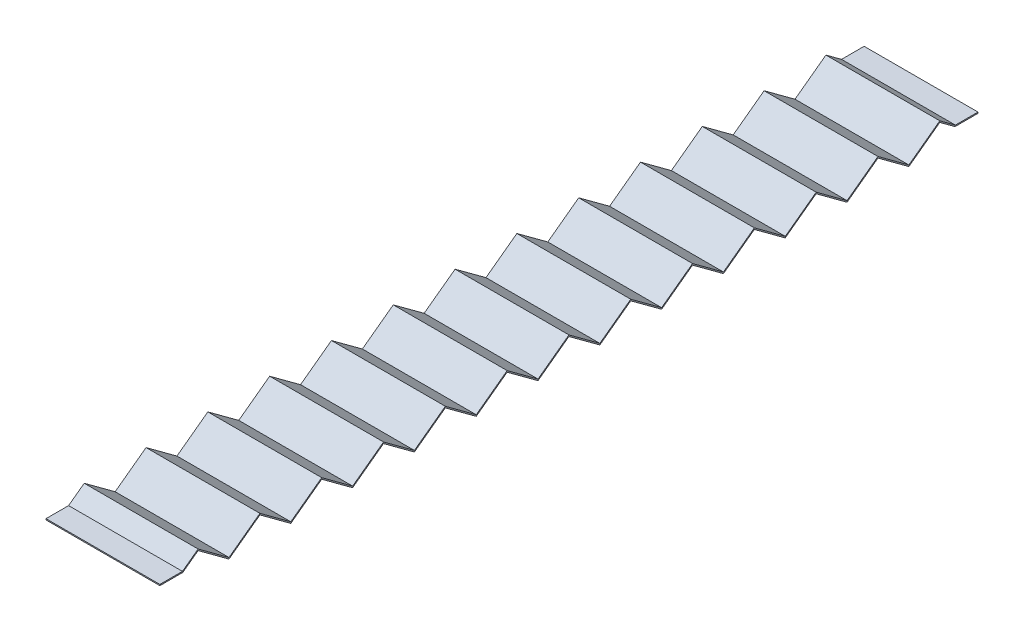
from build123d import *

# Parameters (mm, degrees)
EXTRUDE_THIN1_DEPTH = 25


with BuildPart() as part:
    # Sketch3 → Extrude-Thin1 (new, symmetric)
    with BuildSketch(Plane(origin=(0, 0, 0), x_dir=(0, 0, -1), z_dir=(1, 0, 0))):
        Polygon((0, 4.75), (10.082168565, 4.75), (16.784629538, 9.689445062), (30.353888615, -0.310554938), (43.923147692, 9.689445062), (57.492406769, -0.310554938), (71.061665846, 9.689445062), (84.630924923, -0.310554938), (98.200184, 9.689445062), (111.769443077, -0.310554938), (125.338702154, 9.689445062), (138.907961231, -0.310554938), (152.477220308, 9.689445062), (166.046479384, -0.310554938), (179.615738461, 9.689445062), (193.184997538, -0.310554938), (206.754256615, 9.689445062), (220.323515692, -0.310554938), (233.892774769, 9.689445062), (247.462033846, -0.310554938), (261.031292923, 9.689445062), (274.600552, -0.310554938), (288.169811077, 9.689445062), (301.739070153, -0.310554938), (315.30832923, 9.689445062), (328.877588307, -0.310554938), (342.446847384, 9.689445062), (349.149308358, 4.75), (359.231476923, 4.75), (359.231476923, 5.25), (349.313645487, 5.25), (342.446847384, 10.310554938), (328.877588307, 0.310554938), (315.30832923, 10.310554938), (301.739070153, 0.310554938), (288.169811077, 10.310554938), (274.600552, 0.310554938), (261.031292923, 10.310554938), (247.462033846, 0.310554938), (233.892774769, 10.310554938), (220.323515692, 0.310554938), (206.754256615, 10.310554938), (193.184997538, 0.310554938), (179.615738461, 10.310554938), (166.046479384, 0.310554938), (152.477220308, 10.310554938), (138.907961231, 0.310554938), (125.338702154, 10.310554938), (111.769443077, 0.310554938), (98.200184, 10.310554938), (84.630924923, 0.310554938), (71.061665846, 10.310554938), (57.492406769, 0.310554938), (43.923147692, 10.310554938), (30.353888615, 0.310554938), (16.784629538, 10.310554938), (9.917831435, 5.25), (0, 5.25), align=None)
    extrude(amount=EXTRUDE_THIN1_DEPTH, both=True)


solid = part.part
